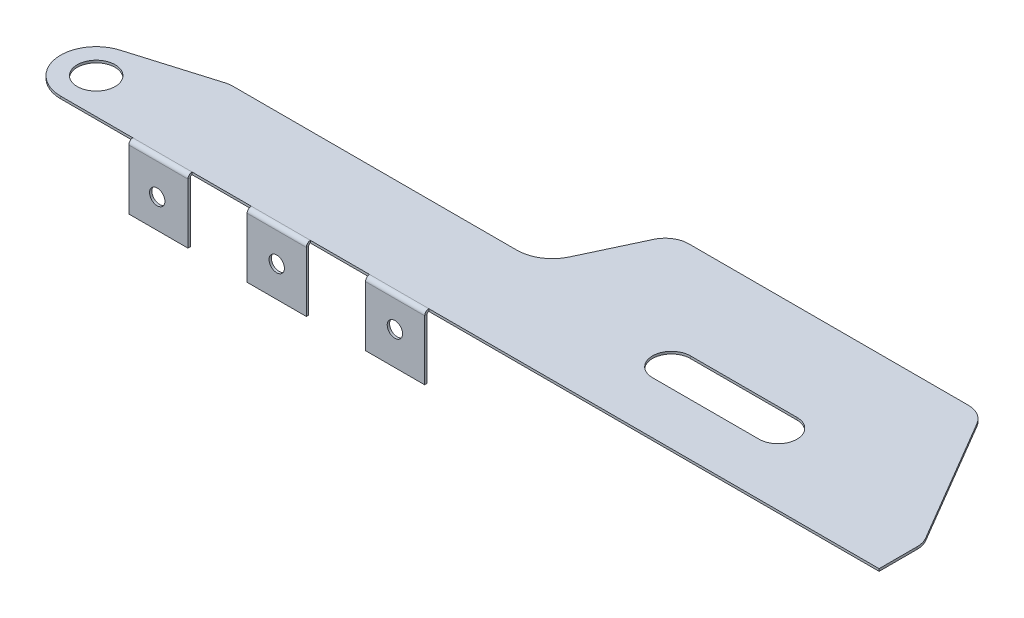
from build123d import *

# Parameters (mm, degrees)
SKETCH2_R          = 8
BASE_FLANGE1_DEPTH = 1
EDGE_FLANGE5_DEPTH = 25
EDGE_FLANGE6_DEPTH = 25
EDGE_FLANGE7_DEPTH = 25
SKETCH29_R         = 3.25
CUT_EXTRUDE2_DEPTH = 10


# Sheet-metal steps are written as plain solids
with BuildPart() as part:
    # Sketch2 → Base-Flange1 (new body)
    with BuildSketch(Plane(origin=(0, 0, 0), x_dir=(1, 0, 0), z_dir=(0, 1, 0))):
        with BuildLine():
            Line((-41.298383568, 48.634081388), (76.701616432, 48.634081388))
            ThreePointArc((76.701616432, 48.634081388), (81.664016801, 47.315935025), (85.318183171, 43.708997903))
            Line((85.318183171, 43.708997903), (116.318183171, -8.925083485))
            ThreePointArc((116.318183171, -8.925083485), (117.349560964, -11.369949372), (117.701616432, -14))
            Line((117.701616432, -14), (117.701616432, -30))
            Line((117.701616432, -30), (-228, -30))
            ThreePointArc((-228, -30), (-242.841901676, -17.172085321), (-232.298383568, -0.629060619))
            Line((-232.298383568, -0.629060619), (-198.163972613, 9.580626254))
            ThreePointArc((-198.163972613, 9.580626254), (-196.746440448, 9.894601117), (-195.298383568, 10))
            Line((-195.298383568, 10), (-75.298383568, 10))
            ThreePointArc((-75.298383568, 10), (-67.251296492, 12.341232699), (-61.716223201, 18.634081388))
            Line((-61.716223201, 18.634081388), (-50.353157146, 42.878027129))
            ThreePointArc((-50.353157146, 42.878027129), (-46.663108285, 47.073259589), (-41.298383568, 48.634081388))
        make_face()
        with Locations(Location((-228, -15, 0), (0, 0, 270))):
            Circle(SKETCH2_R, mode=Mode.SUBTRACT)
        with BuildLine():
            Line((0, 8), (45, 8))
            ThreePointArc((45, 8), (53, 0), (45, -8))
            Line((45, -8), (0, -8))
            ThreePointArc((0, -8), (-8, 0), (0, 8))
        make_face(mode=Mode.SUBTRACT)
    extrude(amount=-BASE_FLANGE1_DEPTH)

    # Edge-Flange5 section (across the edge) → Edge-Flange5 (add)
    with BuildSketch(Plane(origin=(-172.5, -1, 30.7366), x_dir=(0, 0, -1), z_dir=(-1, 0, 0))):
        with BuildLine():
            Line((-1, 0.7366), (-1, 26))
            Line((-1, 26), (0, 26))
            Line((0, 26), (0, 0.7366))
            ThreePointArc((0, 0.7366), (0.215745145, 0.215745145), (0.7366, 0))
            Line((0.7366, 0), (0.7366, -1))
            ThreePointArc((0.7366, -1), (-0.491361636, -0.491361636), (-1, 0.7366))
        make_face()
    extrude(amount=EDGE_FLANGE5_DEPTH)

    # Edge-Flange6 section (across the edge) → Edge-Flange6 (add)
    with BuildSketch(Plane(origin=(-122.5, -1, 30.7366), x_dir=(0, 0, -1), z_dir=(-1, 0, 0))):
        with BuildLine():
            Line((-1, 0.7366), (-1, 26))
            Line((-1, 26), (0, 26))
            Line((0, 26), (0, 0.7366))
            ThreePointArc((0, 0.7366), (0.215745145, 0.215745145), (0.7366, 0))
            Line((0.7366, 0), (0.7366, -1))
            ThreePointArc((0.7366, -1), (-0.491361636, -0.491361636), (-1, 0.7366))
        make_face()
    extrude(amount=EDGE_FLANGE6_DEPTH)

    # Edge-Flange7 section (across the edge) → Edge-Flange7 (add)
    with BuildSketch(Plane(origin=(-72.5, -1, 30.7366), x_dir=(0, 0, -1), z_dir=(-1, 0, 0))):
        with BuildLine():
            Line((-1, 0.7366), (-1, 26))
            Line((-1, 26), (0, 26))
            Line((0, 26), (0, 0.7366))
            ThreePointArc((0, 0.7366), (0.215745145, 0.215745145), (0.7366, 0))
            Line((0.7366, 0), (0.7366, -1))
            ThreePointArc((0.7366, -1), (-0.491361636, -0.491361636), (-1, 0.7366))
        make_face()
    extrude(amount=EDGE_FLANGE7_DEPTH)

    # Sketch29 → Cut-Extrude2 (cut)
    with BuildSketch(Plane.XY.offset(31.7366)):
        with Locations((-85.082297009, -13)):
            Circle(SKETCH29_R)
        with Locations((-135, -14)):
            Circle(SKETCH29_R)
        with Locations((-185.477801268, -14.7366)):
            Circle(SKETCH29_R)
    extrude(amount=-CUT_EXTRUDE2_DEPTH, mode=Mode.SUBTRACT)


solid = part.part
